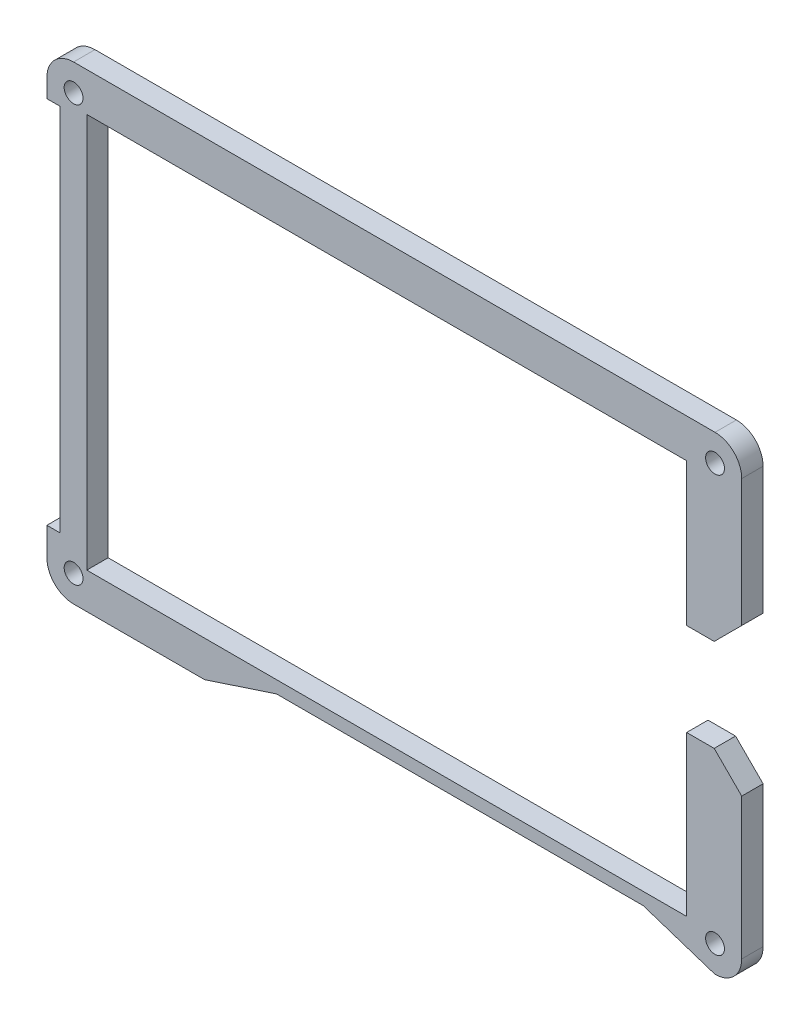
from build123d import *

# Parameters (mm, degrees)
SKETCH1_R           = 1.3462
BOSS_EXTRUDE1_DEPTH = 3.048


with BuildPart() as part:
    # Sketch1 → Boss-Extrude1 (new body)
    with BuildSketch(Plane.XY):
        with BuildLine():
            Line((-401.0571, 150.956597849), (-401.0571, 148.341))
            Line((-401.0571, 148.341), (-399.1521, 148.341))
            Line((-399.1521, 148.341), (-399.1521, 95.6449))
            Line((-399.1521, 95.6449), (-401.0571, 95.6449))
            Line((-401.0571, 95.6449), (-401.0571, 91.659304166))
            ThreePointArc((-401.0571, 91.659304166), (-399.951018769, 88.947400452), (-397.2472, 87.8217))
            Line((-397.2472, 87.8217), (-378.5565, 87.8217))
            Line((-378.5565, 87.8217), (-368.3165, 91.1883))
            Line((-368.3165, 91.1883), (-315.9973, 91.1883))
            Line((-315.9973, 91.1883), (-305.7573, 87.8217))
            ThreePointArc((-305.7573, 87.8217), (-303.063223164, 88.937623164), (-301.9473, 91.6317))
            Line((-301.9473, 91.6317), (-301.9473, 111.74645))
            Line((-301.9473, 111.74645), (-305.87795, 115.6771))
            Line((-305.87795, 115.6771), (-309.8086, 115.6771))
            Line((-309.8086, 115.6771), (-309.8086, 92.9525))
            Line((-309.8086, 92.9525), (-395.3675, 92.9525))
            Line((-395.3675, 92.9525), (-395.3675, 149.2432))
            Line((-395.3675, 149.2432), (-309.8086, 149.2432))
            Line((-309.8086, 149.2432), (-309.8086, 128.8851))
            Line((-309.8086, 128.8851), (-305.87795, 128.8851))
            Line((-305.87795, 128.8851), (-301.9473, 132.81575))
            Line((-301.9473, 132.81575), (-301.9473, 150.9704))
            ThreePointArc((-301.9473, 150.9704), (-303.063223164, 153.664476836), (-305.7573, 154.7804))
            Line((-305.7573, 154.7804), (-397.247125, 154.7804))
            ThreePointArc((-397.247125, 154.7804), (-399.946077222, 153.659592612), (-401.0571, 150.956597849))
        make_face()
        with Locations((-397.247125, 150.9704)):
            Circle(SKETCH1_R, mode=Mode.SUBTRACT)
        with Locations((-305.7573, 150.9704)):
            Circle(SKETCH1_R, mode=Mode.SUBTRACT)
        with Locations((-305.7573, 91.6317)):
            Circle(SKETCH1_R, mode=Mode.SUBTRACT)
        with Locations((-397.2472, 91.6317)):
            Circle(SKETCH1_R, mode=Mode.SUBTRACT)
    extrude(amount=BOSS_EXTRUDE1_DEPTH)


solid = part.part
